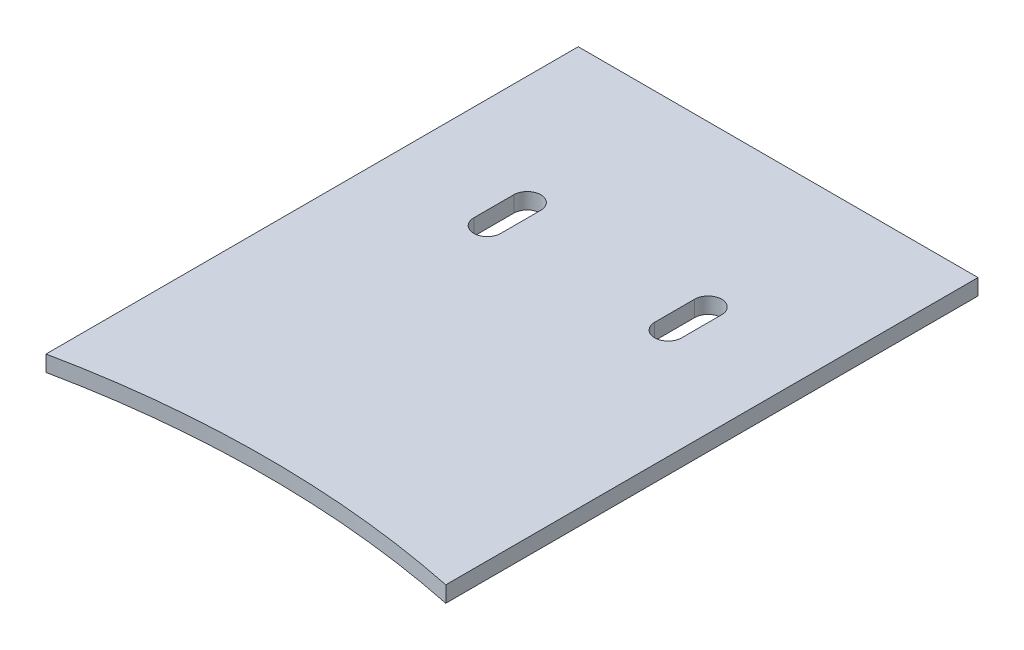
from build123d import *

# Parameters (mm, degrees)
SM_BASE_FLANGE_1_DEPTH = 16


# Sheet-metal steps are written as plain solids
with BuildPart() as part:
    # Sketch 1 → 基体-法兰1 (new body)
    with BuildSketch(Plane(origin=(0, 0, 0), x_dir=(1, 0, 0), z_dir=(0, 1, 0))):
        with BuildLine():
            Line((-200, 964.992357483), (-200, 1497.5))
            Line((-200, 1497.5), (200, 1497.5))
            Line((200, 1497.5), (200, 964.992357483))
            ThreePointArc((200, 964.992357483), (0, 985.5), (-200, 964.992357483))
        make_face()
        with BuildLine():
            Line((-77, 1337), (-77, 1297))
            ThreePointArc((-77, 1297), (-90.5, 1283.5), (-104, 1297))
            Line((-104, 1297), (-104, 1337))
            ThreePointArc((-104, 1337), (-90.5, 1350.5), (-77, 1337))
        make_face(mode=Mode.SUBTRACT)
        with BuildLine():
            Line((77, 1297), (77, 1337))
            ThreePointArc((77, 1337), (90.5, 1350.5), (104, 1337))
            Line((104, 1337), (104, 1297))
            ThreePointArc((104, 1297), (90.5, 1283.5), (77, 1297))
        make_face(mode=Mode.SUBTRACT)
    extrude(amount=SM_BASE_FLANGE_1_DEPTH)


solid = part.part
